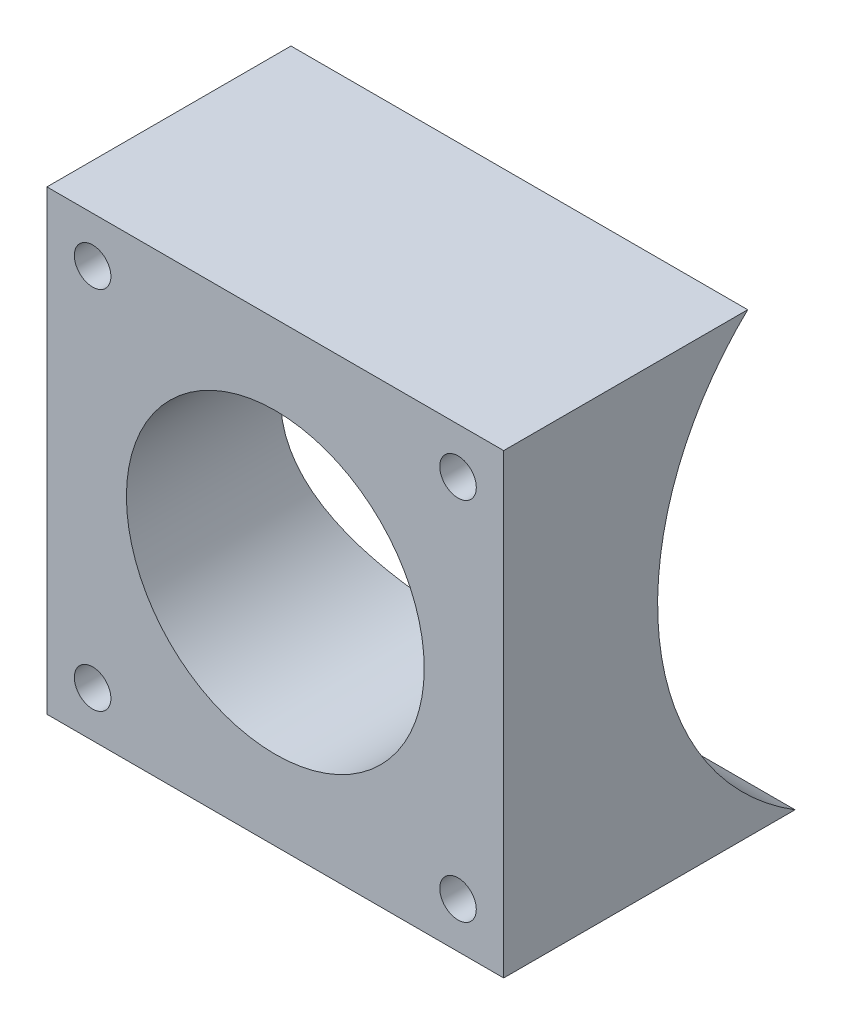
from build123d import *

# Parameters (mm, degrees)
SKETCH1_W               = 50
SKETCH1_H               = 50
SKETCH1_R               = 16.3
SKETCH1_R_2             = 2
BOSS_EXTRUDE1_DEPTH     = 48.6
CUT_EXTRUDE1_DEPTH      = 61.958674526
CUT_EXTRUDE1_DEPTH_BACK = 61.958674526
SKETCH2_R               = 31.75


with BuildPart() as part:
    # Sketch1 → Boss-Extrude1 (new body)
    with BuildSketch(Plane.XY):
        with Locations((0, -2)):
            Rectangle(SKETCH1_W, SKETCH1_H)
        with Locations((0, -2)):
            Circle(SKETCH1_R, mode=Mode.SUBTRACT)
        with Locations((-20, 18)):
            Circle(SKETCH1_R_2, mode=Mode.SUBTRACT)
        with Locations((20, 18)):
            Circle(SKETCH1_R_2, mode=Mode.SUBTRACT)
        with Locations((20, -22)):
            Circle(SKETCH1_R_2, mode=Mode.SUBTRACT)
        with Locations((-20, -22)):
            Circle(SKETCH1_R_2, mode=Mode.SUBTRACT)
    extrude(amount=BOSS_EXTRUDE1_DEPTH)

    # Sketch2 → Cut-Extrude1 (cut, two sides: drawn at the far end of the back side and taken through both)
    with BuildSketch(Plane(origin=(0, 0, 0), x_dir=(0, 0, -1), z_dir=(1, 0, 0)).offset(-CUT_EXTRUDE1_DEPTH_BACK)):
        Circle(SKETCH2_R)
    extrude(amount=CUT_EXTRUDE1_DEPTH + CUT_EXTRUDE1_DEPTH_BACK, mode=Mode.SUBTRACT)


solid = part.part
